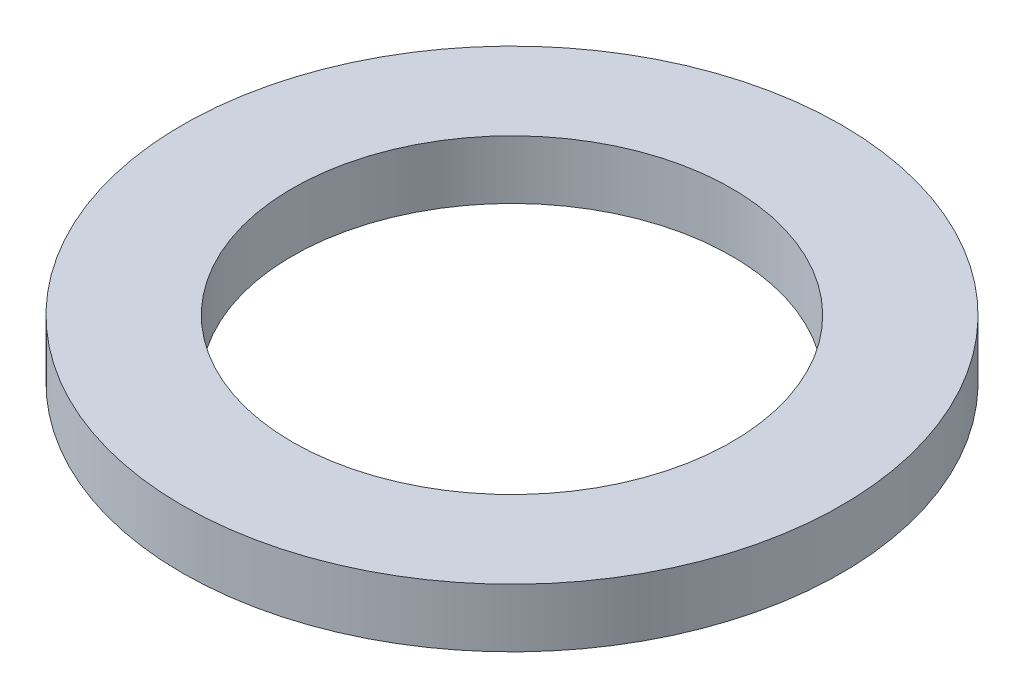
from build123d import *

# Parameters (mm, degrees)
SKETCH1_R           = 45
BOSS_EXTRUDE1_DEPTH = 8
SKETCH2_R           = 30
CUT_EXTRUDE1_DEPTH  = 65.140470843


with BuildPart() as part:
    # Sketch1 → Boss-Extrude1 (new body)
    with BuildSketch(Plane(origin=(0, 0, 0), x_dir=(1, 0, 0), z_dir=(0, 1, 0))):
        Circle(SKETCH1_R)
    extrude(amount=BOSS_EXTRUDE1_DEPTH)

    # Sketch2 → Cut-Extrude1 (cut, through all)
    with BuildSketch(Plane(origin=(0, 0, 0), x_dir=(1, 0, 0), z_dir=(0, 1, 0))):
        Circle(SKETCH2_R)
    extrude(amount=CUT_EXTRUDE1_DEPTH, mode=Mode.SUBTRACT)


solid = part.part
